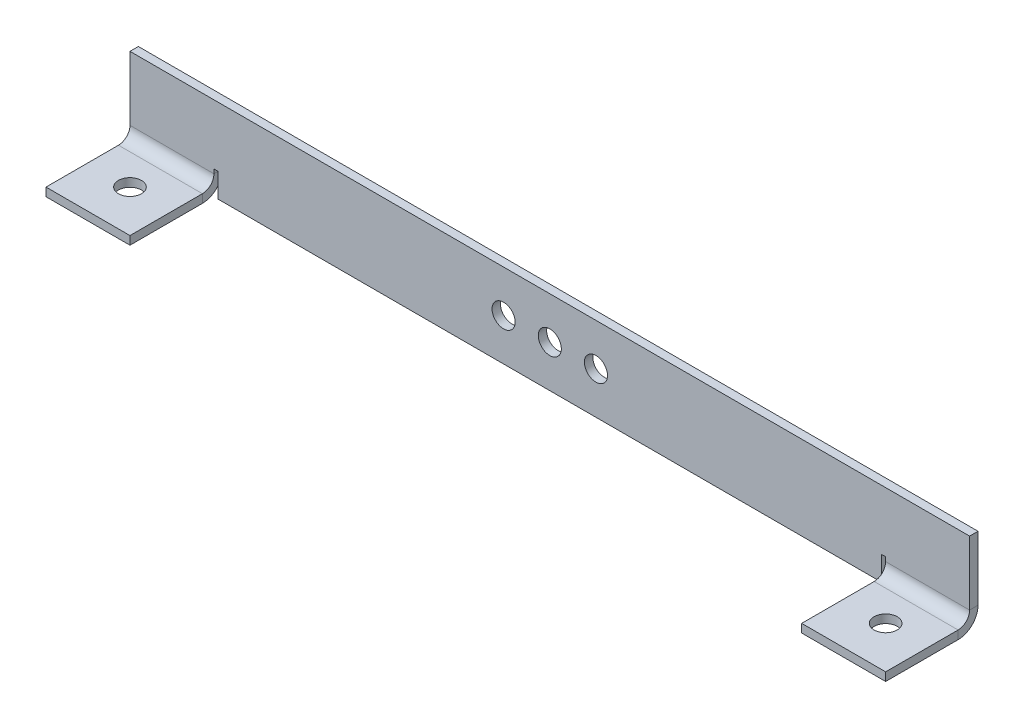
from build123d import *

# Parameters (mm, degrees)
SKETCH_1_W                        = 200
SKETCH_1_H                        = 20
SM_BASE_FLANGE_1_DEPTH            = 2
SM_EDGE_FLANGE_1_STRIP_W          = 13.4732
SM_EDGE_FLANGE_1_STRIP_H          = 2
SM_EDGE_FLANGE_1_STRIP_CUT_DEPTH  = 20
SM_EDGE_FLANGE_1_RELIEF_W         = 14.4732
SM_EDGE_FLANGE_1_RELIEF_H         = 1
SM_EDGE_FLANGE_1_RELIEF_CUT_DEPTH = 2
SM_EDGE_FLANGE_1_DEPTH            = 20
SKETCH_10_R                       = 2.75
CUT_EXTRUDE_2_DEPTH               = 10
SKETCH_11_R                       = 2.75
CUT_EXTRUDE_3_DEPTH               = 10


# Sheet-metal steps are written as plain solids
with BuildPart() as part:
    # Sketch 1 → 基体-法兰1 (new body)
    with BuildSketch(Plane.XY):
        with Locations((0, -10)):
            Rectangle(SKETCH_1_W, SKETCH_1_H)
    extrude(amount=-SM_BASE_FLANGE_1_DEPTH)

    # 边线-法兰1 strip (across the edge) → 边线-法兰1 strip cut (cut)
    with BuildSketch(Plane(origin=(-100, -20, 0), x_dir=(0, 1, 0), z_dir=(1, 0, 0))):
        with Locations((-2, -1)):
            Rectangle(SM_EDGE_FLANGE_1_STRIP_W, SM_EDGE_FLANGE_1_STRIP_H)
    sm_edge_flange_1_strip_cut = extrude(amount=SM_EDGE_FLANGE_1_STRIP_CUT_DEPTH, mode=Mode.SUBTRACT)

    # 边线-法兰1 relief (on the sheet) → 边线-法兰1 relief cut (cut)
    with BuildSketch(Plane(origin=(-100, -15.2634, 0), x_dir=(0, 1, 0), z_dir=(0, 0, 1))):
        with Locations((-6.2366, -20.5)):
            Rectangle(SM_EDGE_FLANGE_1_RELIEF_W, SM_EDGE_FLANGE_1_RELIEF_H)
    sm_edge_flange_1_relief_cut = extrude(amount=-SM_EDGE_FLANGE_1_RELIEF_CUT_DEPTH, mode=Mode.SUBTRACT)

    # 边线-法兰1 section (across the edge) → 边线-法兰1 (add)
    with BuildSketch(Plane(origin=(-100, -20, 0), x_dir=(0, 1, 0), z_dir=(1, 0, 0))):
        with BuildLine():
            Line((0, 2.7366), (0, 20))
            Line((0, 20), (2, 20))
            Line((2, 20), (2, 2.7366))
            ThreePointArc((2, 2.7366), (2.801531583, 0.801531583), (4.7366, 0))
            Line((4.7366, 0), (4.7366, -2))
            ThreePointArc((4.7366, -2), (1.38731802, -0.61268198), (0, 2.7366))
        make_face()
    sm_edge_flange_1 = extrude(amount=SM_EDGE_FLANGE_1_DEPTH)

    # 草图10 → 切除-拉伸2 (cut)
    with BuildSketch(Plane(origin=(0, -18, 0), x_dir=(1, 0, 0), z_dir=(0, 1, 0))):
        with Locations(Location((-90, -10, 0), (0, 0, 270))):
            Circle(SKETCH_10_R)
    cut_extrude_2 = extrude(amount=-CUT_EXTRUDE_2_DEPTH, mode=Mode.SUBTRACT)

    # 镜向1: 边线-法兰1 strip cut, 边线-法兰1 relief cut, 边线-法兰1, 切除-拉伸2 across plane
    add(sm_edge_flange_1_strip_cut.mirror(Plane(origin=(0, 0, 0), x_dir=(0, 0, 1), z_dir=(1, 0, 0))), mode=Mode.SUBTRACT)
    add(sm_edge_flange_1_relief_cut.mirror(Plane(origin=(0, 0, 0), x_dir=(0, 0, 1), z_dir=(1, 0, 0))), mode=Mode.SUBTRACT)
    add(sm_edge_flange_1.mirror(Plane(origin=(0, 0, 0), x_dir=(0, 0, 1), z_dir=(1, 0, 0))))
    add(cut_extrude_2.mirror(Plane(origin=(0, 0, 0), x_dir=(0, 0, 1), z_dir=(1, 0, 0))), mode=Mode.SUBTRACT)

    # 草图11 → 切除-拉伸3 (cut)
    with BuildSketch(Plane(origin=(0, 0, -2), x_dir=(-1, 0, 0), z_dir=(0, 0, -1))):
        with Locations((0, -10)):
            Circle(SKETCH_11_R)
        with Locations((-11, -10)):
            Circle(SKETCH_11_R)
        with Locations(Location((11, -10, 0), (0, 0, 180))):
            Circle(SKETCH_11_R)
    extrude(amount=-CUT_EXTRUDE_3_DEPTH, mode=Mode.SUBTRACT)


solid = part.part
